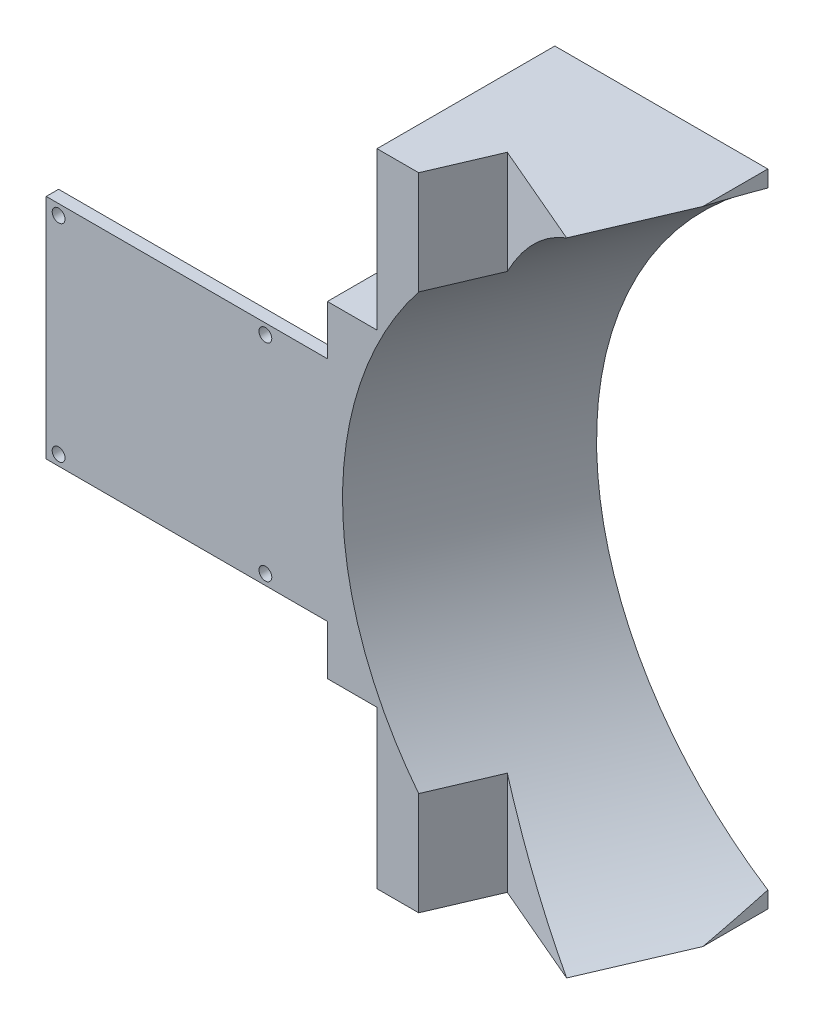
from build123d import *

# Parameters (mm, degrees)
SKETCH_1_W          = 80
SKETCH_1_H          = 55
EXTRUDE_1_DEPTH     = 3
SKETCH_2_R          = 1.55
CUT_EXTRUDE_1_DEPTH = 24.5
SKETCH_3_W          = 3
SKETCH_3_H          = 55
EXTRUDE_2_DEPTH     = 1.5
SKETCH_5_W          = 3
SKETCH_5_H          = 55
EXTRUDE_3_DEPTH     = 50
SKETCH_6_W          = 51.5
SKETCH_6_H          = 3
EXTRUDE_4_DEPTH     = 50
SKETCH_7_W          = 51.5
SKETCH_7_H          = 3
EXTRUDE_5_DEPTH     = 50
SKETCH_8_W          = 51.5
SKETCH_8_H          = 155
EXTRUDE_6_DEPTH     = 40
EXTRUDE_7_DEPTH     = 12
CUT_EXTRUDE_2_DEPTH = 184
SKETCH_13_R         = 90
CUT_EXTRUDE_3_DEPTH = 92


with BuildPart() as part:
    # 草图1 → 凸台-拉伸1 (new body)
    with BuildSketch(Plane.XY):
        Rectangle(SKETCH_1_W, SKETCH_1_H)
    extrude(amount=EXTRUDE_1_DEPTH)

    # 草图2 → 切除-拉伸1 (cut)
    with BuildSketch(Plane(origin=(0, 0, 0), x_dir=(-1, 0, 0), z_dir=(0, 0, -1))):
        with Locations((37, 25)):
            Circle(SKETCH_2_R)
        with Locations((37, -25)):
            Circle(SKETCH_2_R)
        with Locations((-13, 25)):
            Circle(SKETCH_2_R)
        with Locations((-13, -25)):
            Circle(SKETCH_2_R)
    extrude(amount=-CUT_EXTRUDE_1_DEPTH, mode=Mode.SUBTRACT)



with BuildPart() as body_2:
    # 草图3 → 凸台-拉伸2 (new body)
    with BuildSketch(Plane(origin=(40, 0, 0), x_dir=(0, 0, -1), z_dir=(1, 0, 0))):
        with Locations((-1.5, 0)):
            Rectangle(SKETCH_3_W, SKETCH_3_H)
    extrude(amount=EXTRUDE_2_DEPTH)

    # 草图5 → 凸台-拉伸3 (add)
    with BuildSketch(Plane(origin=(41.5, 0, 0), x_dir=(0, 0, -1), z_dir=(1, 0, 0))):
        with Locations((-1.5, 0)):
            Rectangle(SKETCH_5_W, SKETCH_5_H)
    extrude(amount=EXTRUDE_3_DEPTH)


with BuildPart() as part_1:
    add(part.part)

    add(body_2.part)  # 凸台-拉伸4 merges body 2
    # 草图6 → 凸台-拉伸4 (add)
    with BuildSketch(Plane(origin=(0, 27.5, 0), x_dir=(1, 0, 0), z_dir=(0, 1, 0))):
        with Locations((65.75, -1.5)):
            Rectangle(SKETCH_6_W, SKETCH_6_H)
    extrude(amount=EXTRUDE_4_DEPTH)

    # 草图7 → 凸台-拉伸5 (add)
    with BuildSketch(Plane.XZ.offset(27.5)):
        with Locations((65.75, 1.5)):
            Rectangle(SKETCH_7_W, SKETCH_7_H)
    extrude(amount=EXTRUDE_5_DEPTH)

    # 草图8 → 凸台-拉伸6 (add)
    with BuildSketch(Plane(origin=(0, 0, 0), x_dir=(-1, 0, 0), z_dir=(0, 0, -1))):
        with Locations((-65.75, 0)):
            Rectangle(SKETCH_8_W, SKETCH_8_H)
    extrude(amount=EXTRUDE_6_DEPTH)

    # 草图9 → 凸台-拉伸7 (add)
    with BuildSketch(Plane.ZY.offset(-40)):
        Polygon((-40, 39.5), (3, 39.5), (3, 27.5), (0, 27.5), (0, -27.5), (3, -27.5), (3, -39.5), (-40, -39.5), align=None)
    extrude(amount=EXTRUDE_7_DEPTH)

    # 草图10 → 切除-拉伸2 (cut)
    with BuildSketch(Plane(origin=(0, 77.5, 0), x_dir=(1, 0, 0), z_dir=(0, 1, 0))):
        Polygon((56.5, 12), (91.5, -3), (50.071428571, -3), align=None)
    extrude(amount=-CUT_EXTRUDE_2_DEPTH, mode=Mode.SUBTRACT)

    # 草图13 → 切除-拉伸3 (cut, symmetric)
    with BuildSketch(Plane(origin=(13.112068966, 0, -30.594827586), x_dir=(0.9191450300180579, 0, 0.39391929857916774), z_dir=(-0.39391929857916774, 0, 0.9191450300180579))):
        with Locations((120.283528142, 0)):
            Circle(SKETCH_13_R)
    extrude(amount=CUT_EXTRUDE_3_DEPTH, both=True, mode=Mode.SUBTRACT)


solid = part_1.part
